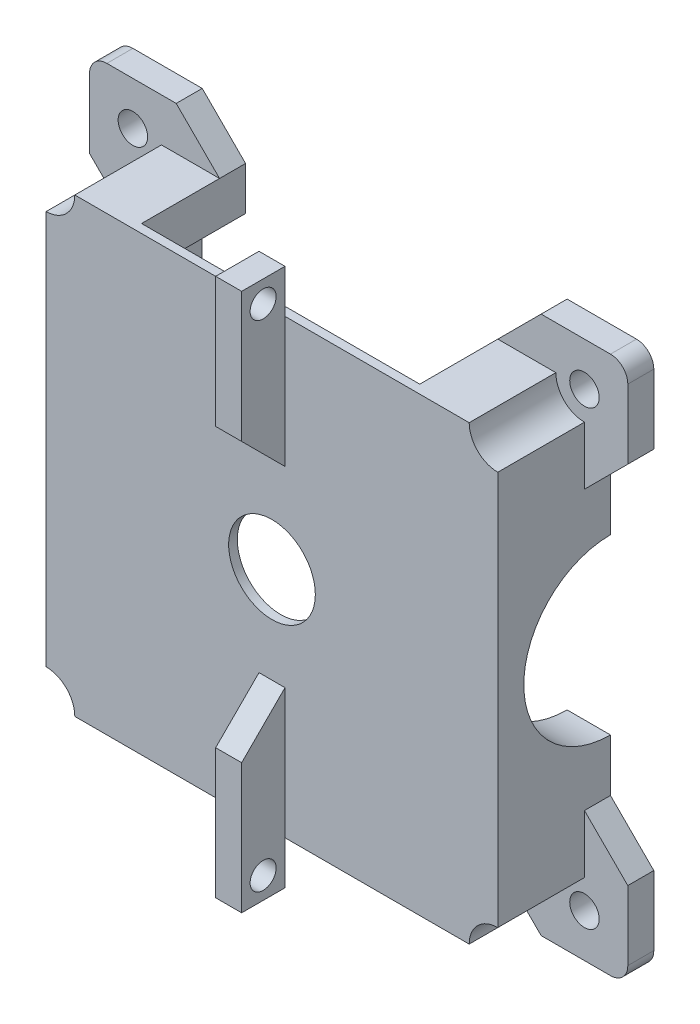
from build123d import *

# Parameters (mm, degrees)
CROQUIS1_W                       = 52.1
CROQUIS1_H                       = 52.1
SALIENTE_EXTRUIR1_DEPTH          = 13
CROQUIS2_W                       = 42.1
CROQUIS2_H                       = 42.1
CORTAR_EXTRUIR1_DEPTH            = 12
SALIENTE_EXTRUIR2_DEPTH          = 3
TALADRO_DE_MARGEN_PARA_M31_D     = 3.4
TALADRO_START                    = 3
TALADRO_DE_MARGEN_PARA_M61_DEPTH = 10
REDONDEO1_R                      = 2
CROQUIS10_R                      = 5
CORTAR_EXTRUIR2_DEPTH            = 1
MATRIZC1_COUNT                   = 4
REDONDEO1_OF_MATRIZC1_R          = 2
CORTAR_EXTRUIR3_REACH            = 47.795
CROQUIS11_W                      = 32.1
CROQUIS11_H                      = 5
CORTAR_EXTRUIR4_REACH            = 68.284
CROQUIS12_R                      = 10
CROQUIS13_R                      = 1.5
SALIENTE_EXTRUIR3_DEPTH          = 1.5


# Read off the part's stored shape, not the designer's step: Taladro de margen para M61
with BuildPart() as part:
    # Croquis1 → Saliente-Extruir1 (new body)
    with BuildSketch(Plane.XY):
        Rectangle(CROQUIS1_W, CROQUIS1_H)
    extrude(amount=SALIENTE_EXTRUIR1_DEPTH)

    # Croquis2 → Cortar-Extruir1 (cut)
    with BuildSketch(Plane(origin=(0, 0, 0), x_dir=(-1, 0, 0), z_dir=(0, 0, -1))):
        Rectangle(CROQUIS2_W, CROQUIS2_H)
    extrude(amount=-CORTAR_EXTRUIR1_DEPTH, mode=Mode.SUBTRACT)

    # Croquis3 → Saliente-Extruir2 (add)
    with BuildSketch(Plane(origin=(0, 0, 0), x_dir=(-1, 0, 0), z_dir=(0, 0, -1))):
        Polygon((-31.05, 21.05), (-26.05, 16.05), (-26.05, 21.05), (-21.05, 21.05), (-21.05, 26.05), (-16.05, 26.05), (-21.05, 31.05), (-31.05, 31.05), align=None)
    saliente_extruir2 = extrude(amount=-SALIENTE_EXTRUIR2_DEPTH)

    # Taladro de margen para M31 (through all)
    with Locations(Plane(origin=(0, 0, 0), x_dir=(-1, 0, 0), z_dir=(0, 0, -1))):
        with Locations((-26.05, 26.05)):
            taladro_de_margen_para_m31 = Hole(TALADRO_DE_MARGEN_PARA_M31_D / 2)

    # Taladro de margen para M61 outline → Taladro de margen para M61 (cut)
    with BuildSketch(Plane.XY.offset(TALADRO_START)):
        with BuildLine():
            Line((24.35, 26.05), (22.75, 26.05))
            ThreePointArc((22.75, 26.05), (23.716547622, 23.716547622), (26.05, 22.75))
            Line((26.05, 22.75), (26.05, 24.35))
            ThreePointArc((26.05, 24.35), (24.847918472, 24.847918472), (24.35, 26.05))
        make_face()
    taladro_de_margen_para_m61 = extrude(amount=TALADRO_DE_MARGEN_PARA_M61_DEPTH, mode=Mode.SUBTRACT)

    # Redondeo1
    redondeo1_edges = [part.edges().sort_by_distance(p)[0] for p in [
        (31.05, 31.05, 1.5),
    ]]
    fillet(redondeo1_edges, radius=REDONDEO1_R)

    # Croquis10 → Cortar-Extruir2 (cut)
    with BuildSketch(Plane.XY.offset(13)):
        Circle(CROQUIS10_R)
    extrude(amount=-CORTAR_EXTRUIR2_DEPTH, mode=Mode.SUBTRACT)

    # MatrizC1: Saliente-Extruir2, Taladro de margen para M31, Taladro de margen para M61 ×4 about axis
    matrizc1_axis = Axis((0, 0, 0), (0, 0, 1))
    add([saliente_extruir2.rotate(matrizc1_axis, i * 360 / MATRIZC1_COUNT) for i in range(1, MATRIZC1_COUNT)])
    add([taladro_de_margen_para_m31.rotate(matrizc1_axis, i * 360 / MATRIZC1_COUNT) for i in range(1, MATRIZC1_COUNT)], mode=Mode.SUBTRACT)
    add([taladro_de_margen_para_m61.rotate(matrizc1_axis, i * 360 / MATRIZC1_COUNT) for i in range(1, MATRIZC1_COUNT)], mode=Mode.SUBTRACT)

    # Redondeo1 of MatrizC1
    redondeo1_of_matrizc1_edges = [part.edges().sort_by_distance(p)[0] for p in [
        (-31.05, 31.05, 1.5),
        (-31.05, -31.05, 1.5),
        (31.05, -31.05, 1.5),
    ]]
    fillet(redondeo1_of_matrizc1_edges, radius=REDONDEO1_OF_MATRIZC1_R)

    # Cortar-Extruir3: up to this face of the body (flat: up to its plane)
    cortar_extruir3_end = Plane(part.part.faces().sort_by_distance((20.45461609, 0, 12))[0])
    # Croquis11 → Cortar-Extruir3 (cut, up to the picked face)
    with BuildSketch(Plane(origin=(0, 0, 0), x_dir=(-1, 0, 0), z_dir=(0, 0, -1)), mode=Mode.PRIVATE) as cortar_extruir3_sk1:
        with Locations((0, 23.55)):
            Rectangle(CROQUIS11_W, CROQUIS11_H)
    cortar_extruir3_tool1 = split(extrude(cortar_extruir3_sk1.sketch, amount=-CORTAR_EXTRUIR3_REACH, mode=Mode.PRIVATE), bisect_by=cortar_extruir3_end, keep=Keep.BOTH, mode=Mode.PRIVATE)
    add(cortar_extruir3_tool1.solids().sort_by(Axis((0, 23.55, 0), (0, 0, 1)))[0], mode=Mode.SUBTRACT)

    # Cortar-Extruir4: up to this face of the body (flat: up to its plane)
    cortar_extruir4_end = Plane(part.part.faces().sort_by_distance((26.05, 0, 6.864592781))[0])
    # Croquis12 → Cortar-Extruir4 (cut, up to the picked face)
    with BuildSketch(Plane.ZY.offset(26.05), mode=Mode.PRIVATE) as cortar_extruir4_sk1:
        Circle(CROQUIS12_R)
    cortar_extruir4_tool1 = split(extrude(cortar_extruir4_sk1.sketch, amount=-CORTAR_EXTRUIR4_REACH, mode=Mode.PRIVATE), bisect_by=cortar_extruir4_end, keep=Keep.BOTH, mode=Mode.PRIVATE)
    add(cortar_extruir4_tool1.solids().sort_by(Axis((-26.05, 0, 0), (1, 0, 0)))[0], mode=Mode.SUBTRACT)

    # Croquis13 → Saliente-Extruir3 (add, symmetric)
    with BuildSketch(Plane(origin=(0, 0, 0), x_dir=(0, 0, -1), z_dir=(1, 0, 0))):
        Polygon((-13, 16.05), (-13, 31.05), (-18, 31.05), (-18, 16.05), (-13, 11.05), align=None)
        with Locations((-15.523423592, 28.55)):
            Circle(CROQUIS13_R, mode=Mode.SUBTRACT)
    saliente_extruir3 = extrude(amount=SALIENTE_EXTRUIR3_DEPTH, both=True)

    # Simetría1: Saliente-Extruir3 across plane
    add(saliente_extruir3.mirror(Plane.ZX))


solid = part.part
